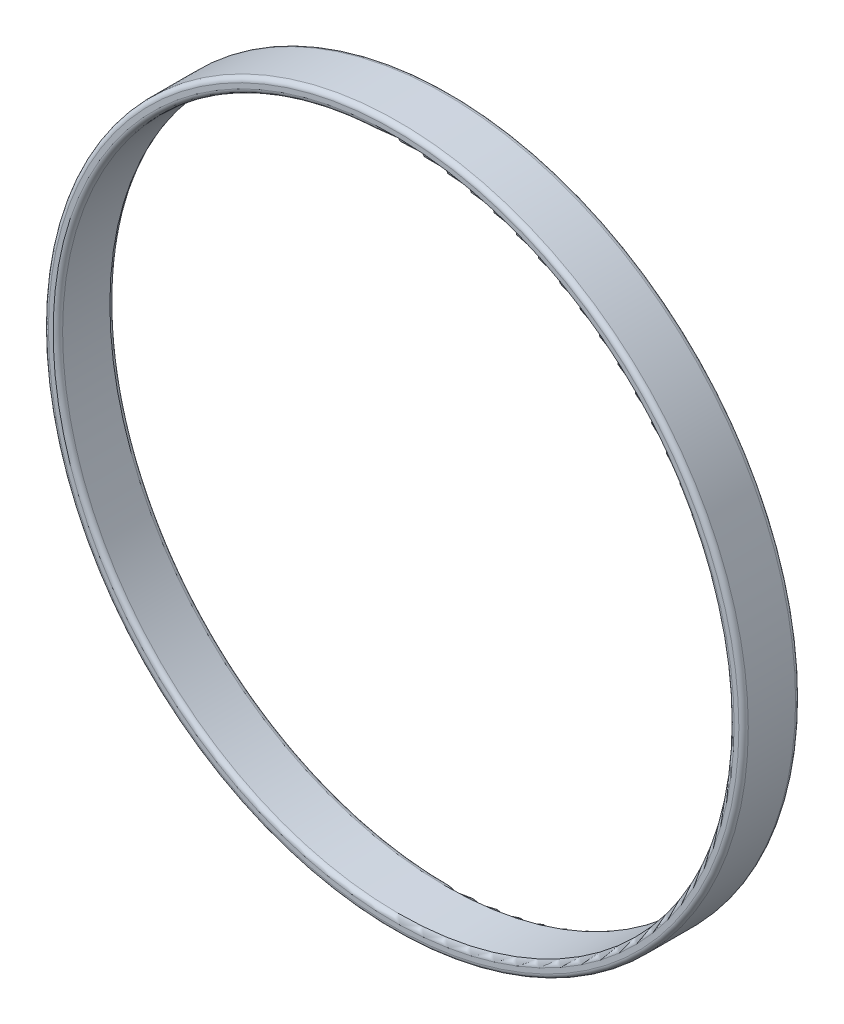
from build123d import *

# Parameters (mm, degrees)
SKETCH2_R           = 37
SKETCH2_R_2         = 35.5
BOSS_EXTRUDE1_DEPTH = 6
FILLET1_R           = 0.5


with BuildPart() as part:
    # Sketch2 → Boss-Extrude1 (new body)
    with BuildSketch(Plane.XY):
        Circle(SKETCH2_R)
        Circle(SKETCH2_R_2, mode=Mode.SUBTRACT)
    extrude(amount=BOSS_EXTRUDE1_DEPTH)

    # Fillet1
    fillet1_edges = [part.edges().sort_by_distance(p)[0] for p in [
        (-35.5, 0, 0),
        (-37, 0, 0),
        (-35.5, 0, 6),
        (-37, 0, 6),
    ]]
    fillet(fillet1_edges, radius=FILLET1_R)


solid = part.part
